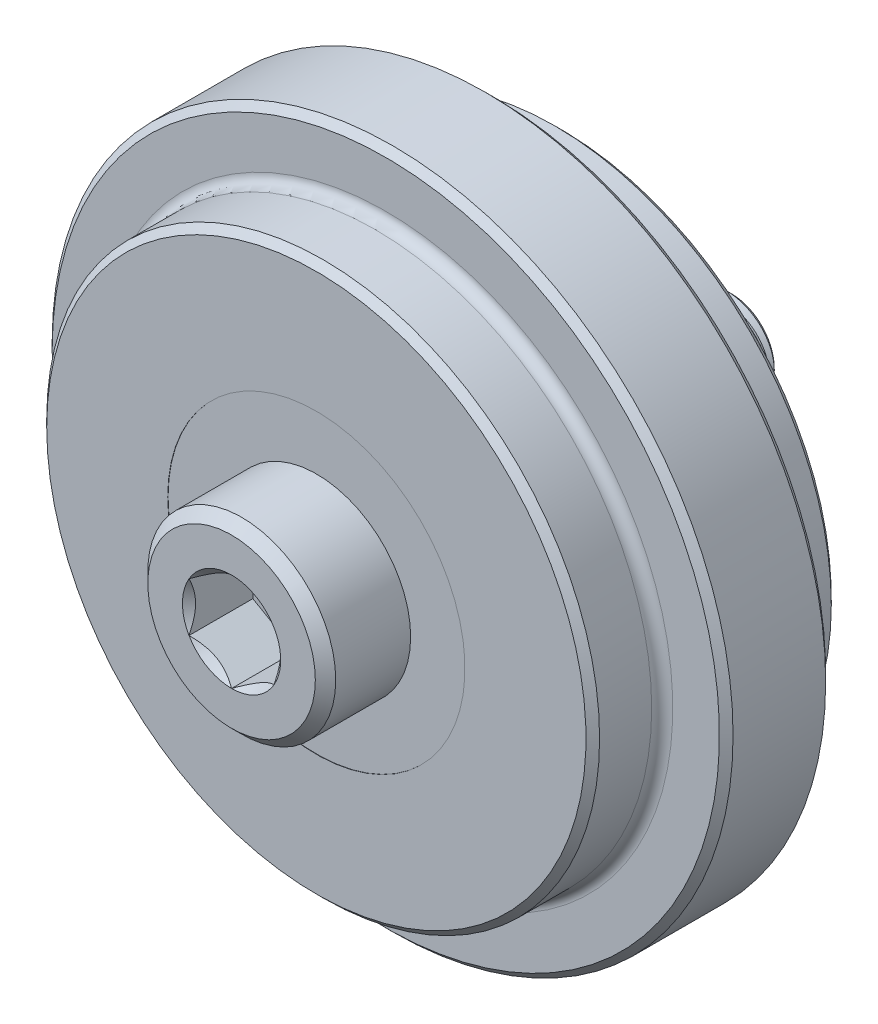
from build123d import *

# Parameters (mm, degrees)
SKETCH2_W          = 7.112
SKETCH2_H          = 6.3246
CUT_SWEEP1_PITCH   = 1.411111111
CUT_EXTRUDE1_DEPTH = 4.7625
SKETCH8_W          = 3.175
SKETCH8_H          = 5.1435


with BuildPart() as part:
    # Sketch1 → Revolve1 (revolve)
    with BuildSketch(Plane(origin=(0, 0, 0), x_dir=(0, 0, -1), z_dir=(1, 0, 0)), mode=Mode.PRIVATE) as revolve1_sk:
        with BuildLine():
            Line((-2.0066, 9.525), (2.0066, 9.525))
            Line((2.0066, 9.525), (2.0066, 11.0871))
            Line((2.0066, 11.0871), (9.144, 11.0871))
            Line((9.144, 11.0871), (9.144, 20.1295))
            Line((9.144, 20.1295), (8.636, 20.6375))
            Line((8.636, 20.6375), (4.7498, 20.6375))
            ThreePointArc((4.7498, 20.6375), (4.19302412, 20.86812412), (3.9624, 21.4249))
            Line((3.9624, 21.4249), (3.9624, 24.892))
            Line((3.9624, 24.892), (3.4544, 25.4))
            Line((3.4544, 25.4), (-3.4544, 25.4))
            Line((-3.4544, 25.4), (-3.9624, 24.892))
            Line((-3.9624, 24.892), (-3.9624, 21.4122))
            ThreePointArc((-3.9624, 21.4122), (-4.19302412, 20.85542412), (-4.7498, 20.6248))
            Line((-4.7498, 20.6248), (-8.636, 20.6248))
            Line((-8.636, 20.6248), (-9.144, 20.1168))
            Line((-9.144, 20.1168), (-9.144, 11.0871))
            Line((-9.144, 11.0871), (-2.0066, 11.0871))
            Line((-2.0066, 11.0871), (-2.0066, 9.525))
        make_face()
    revolve(revolve1_sk.sketch.rotate(Axis((0, 0, -9.144), (0, 0, 1)), 90), axis=Axis((0, 0, -9.144), (0, 0, 1)))


with BuildPart() as body_2:
    # Sketch2 → Revolve2 (revolve)
    with BuildSketch(Plane(origin=(0, 0, 0), x_dir=(0, 0, -1), z_dir=(1, 0, 0)), mode=Mode.PRIVATE) as revolve2_sk:
        with Locations((5.5626, 7.9502)):
            Rectangle(SKETCH2_W, SKETCH2_H)
        with Locations((-5.5626, 7.9502)):
            Rectangle(SKETCH2_W, SKETCH2_H)
    revolve(revolve2_sk.sketch.rotate(Axis((0, 0, 9.144), (0, 0, -1)), 90), axis=Axis((0, 0, 9.144), (0, 0, -1)))


with BuildPart() as body_3:
    # Sketch3 → Revolve3 (revolve)
    with BuildSketch(Plane(origin=(0, 0, 0), x_dir=(0, 0, -1), z_dir=(1, 0, 0)), mode=Mode.PRIVATE) as revolve3_sk:
        with BuildLine():
            Line((-15.4686, 0), (-15.4686, 6.2484))
            Line((-15.4686, 6.2484), (-14.7066, 7.0104))
            Line((-14.7066, 7.0104), (-9.1186, 7.0104))
            Line((-9.1186, 7.0104), (-9.1186, 4.7244))
            ThreePointArc((-9.1186, 4.7244), (-9.044205122, 4.544794878), (-8.8646, 4.4704))
            Line((-8.8646, 4.4704), (-7.0104, 4.4704))
            ThreePointArc((-7.0104, 4.4704), (-6.830794878, 4.544794878), (-6.7564, 4.7244))
            Line((-6.7564, 4.7244), (9.9314, 4.7244))
            Line((9.9314, 4.7244), (9.9314, 3.7338))
            ThreePointArc((9.9314, 3.7338), (10.117387194, 3.284787194), (10.5664, 3.0988))
            Line((10.5664, 3.0988), (11.684, 3.0988))
            ThreePointArc((11.684, 3.0988), (11.863605122, 3.173194878), (11.938, 3.3528))
            Line((11.938, 3.3528), (11.938, 3.9624))
            Line((11.938, 3.9624), (21.0566, 3.9624))
            Line((21.0566, 3.9624), (21.8186, 3.2004))
            Line((21.8186, 3.2004), (21.8186, 0))
            Line((21.8186, 0), (-15.4686, 0))
        make_face()
    revolve(revolve3_sk.sketch.rotate(Axis((0, 0, 15.4686), (0, 0, -1)), 90), axis=Axis((0, 0, 15.4686), (0, 0, -1)))

    # Cut-Sweep1: the profile of Sketch5 profile screwed along a right-hand helix of 8.002 turns, 8 arcs to a turn; built about Z, then put on its axis
    cut_sweep1_z = Axis((0, 0, 0), (0, 0, 1))
    cut_sweep1_corners = [(4.038778629, 0, 0.044097222), (3.0985, 0, -0.498772898), (3.0985, 0, -0.735949325), (4.038778629, 0, -1.278819444)]
    with BuildLine(mode=Mode.PRIVATE) as cut_sweep1_profile:
        Line(cut_sweep1_corners[0], cut_sweep1_corners[1])
        Line(cut_sweep1_corners[1], cut_sweep1_corners[2])
        Line(cut_sweep1_corners[2], cut_sweep1_corners[3])
        Line(cut_sweep1_corners[3], cut_sweep1_corners[0])
    cut_sweep1_cap = Face(cut_sweep1_profile.wire())
    cut_sweep1_turn_angles = [0, 22.5, 45, 67.5, 90, 112.5, 135, 157.5, 180, 202.5, 225, 247.5, 270, 292.5, 315, 337.5, 360]
    cut_sweep1_turn_weights = [1, 0.9238795325112867, 1, 0.9238795325112867, 1, 0.9238795325112867, 1, 0.9238795325112867, 1, 0.9238795325112867, 1, 0.9238795325112867, 1, 0.9238795325112867, 1, 0.9238795325112867, 1]
    cut_sweep1_turn_rails = [Edge.make_bspline([Vector(p[0], p[1], 0).rotate(cut_sweep1_z, cut_sweep1_turn_angles[k]) / cut_sweep1_turn_weights[k] + Vector(0, 0, p[2] + CUT_SWEEP1_PITCH * cut_sweep1_turn_angles[k] / 360) for k in range(17)], [0, 0, 0, 1, 1, 2, 2, 3, 3, 4, 4, 5, 5, 6, 6, 7, 7, 8, 8, 8], 2, cut_sweep1_turn_weights) for p in cut_sweep1_corners]
    cut_sweep1_turn_sides = [Face.make_surface_from_curves(cut_sweep1_turn_rails[p[0]], cut_sweep1_turn_rails[p[1]]) for p in [(0, 1), (1, 2), (2, 3), (3, 0)]]
    cut_sweep1_last_angles = [2880, 2880.36, 2880.72]
    cut_sweep1_last_weights = [1, 0.9999802608561369, 1]
    cut_sweep1_last_rails = [Edge.make_bspline([Vector(p[0], p[1], 0).rotate(cut_sweep1_z, cut_sweep1_last_angles[k]) / cut_sweep1_last_weights[k] + Vector(0, 0, p[2] + CUT_SWEEP1_PITCH * cut_sweep1_last_angles[k] / 360) for k in range(3)], [0, 0, 0, 1, 1, 1], 2, cut_sweep1_last_weights) for p in cut_sweep1_corners]
    cut_sweep1_last_sides = [Face.make_surface_from_curves(cut_sweep1_last_rails[p[0]], cut_sweep1_last_rails[p[1]]) for p in [(0, 1), (1, 2), (2, 3), (3, 0)]]
    cut_sweep1 = Plane(origin=(0, 0, -21.8186), x_dir=(0, 1, 0), z_dir=(0, 0, 1)) * Solid(Shell([*[p.moved(Location((0, 0, CUT_SWEEP1_PITCH * i))) for i in range(8) for p in cut_sweep1_turn_sides], *cut_sweep1_last_sides, cut_sweep1_cap, cut_sweep1_cap.rotate(cut_sweep1_z, 2880.72).moved(Location((0, 0, CUT_SWEEP1_PITCH * 2880.72 / 360)))]))
    add(cut_sweep1, mode=Mode.SUBTRACT)

    # Sketch6 → Cut-Extrude1 (cut)
    with BuildSketch(Plane.XY.offset(15.4686)):
        Polygon((0, 3.666174209), (-3.175, 1.833087105), (-3.175, -1.833087105), (0, -3.666174209), (3.175, -1.833087105), (3.175, 1.833087105), align=None)
    extrude(amount=-CUT_EXTRUDE1_DEPTH, mode=Mode.SUBTRACT)

    # Cut-Extrude2 cone 1 section (through the dimple's axis) → Cut-Extrude2 (revolve, cut)
    with BuildSketch(Plane(origin=(0, 0, 15.4686), x_dir=(0, -1, 0), z_dir=(1, 0, 0))):
        Polygon((0, 0), (3.666174209, 0), (0, 3.666174209), align=None)
    revolve(axis=Axis((0, 0, 15.4686), (0, 0, -1)), mode=Mode.SUBTRACT)


with BuildPart() as body_4:
    # Sketch8 → Revolve4 (revolve)
    with BuildSketch(Plane(origin=(0, 0, 0), x_dir=(0, 0, -1), z_dir=(1, 0, 0)), mode=Mode.PRIVATE) as revolve4_sk:
        with Locations((10.7061, 6.95325)):
            Rectangle(SKETCH8_W, SKETCH8_H)
    revolve(revolve4_sk.sketch.rotate(Axis((0, 0, 9.144), (0, 0, -1)), 90), axis=Axis((0, 0, 9.144), (0, 0, -1)))


solid = Compound([part.part, body_2.part, body_3.part, body_4.part])
